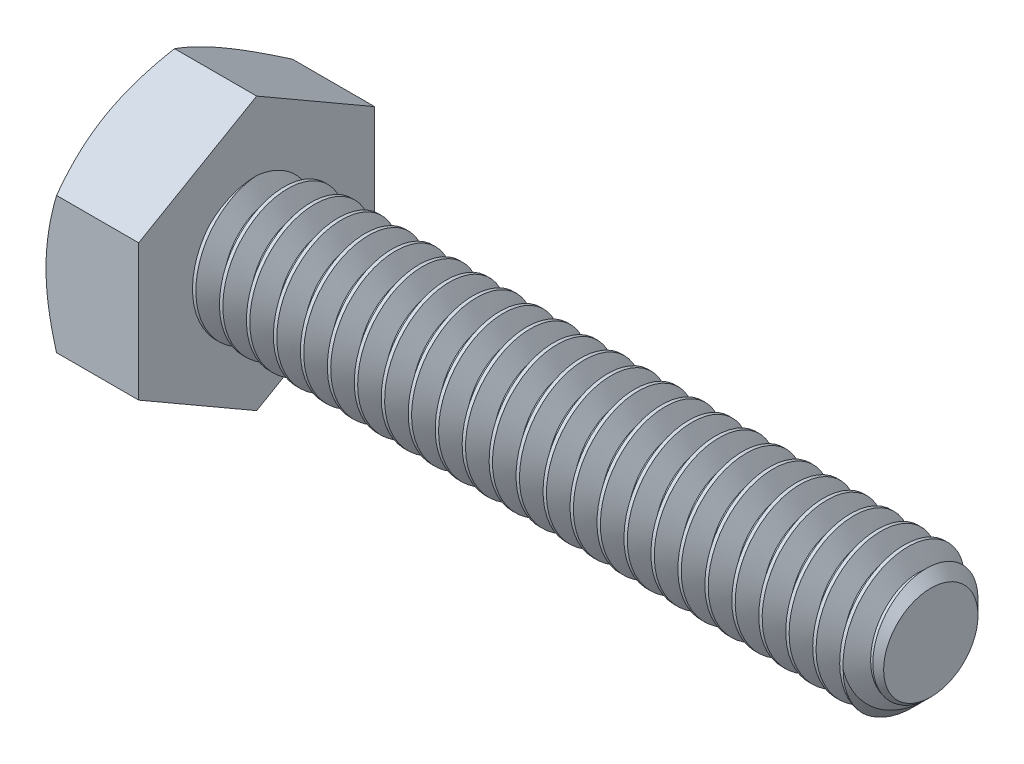
from build123d import *

# Parameters (mm, degrees)
SKETCH5_R           = 3.175
BOSS_EXTRUDE3_DEPTH = 31.75
CHAMFER1_SIZE       = 0.9525
CUT_SWEEP1_PITCH    = 1.27
BOSS_EXTRUDE4_DEPTH = 4.365625
SKETCH8_OUTSIDE_W   = 153.074
SKETCH8_OUTSIDE_H   = 154.794
SKETCH8_OUTSIDE_R   = 5.55625
CUT_EXTRUDE3_DEPTH  = 38.099499254
CUT_EXTRUDE3_DRAFT  = -60
CUT_EXTRUDE4_DEPTH  = 0.254
CIRPATTERN1_COUNT   = 6


with BuildPart() as part:
    # Sketch5 → Boss-Extrude3 (new body)
    with BuildSketch(Plane(origin=(18.0578125, 0, 0), x_dir=(0, 0, -1), z_dir=(1, 0, 0))):
        Circle(SKETCH5_R)
    extrude(amount=-BOSS_EXTRUDE3_DEPTH)

    # Chamfer1
    chamfer1_edges = [part.edges().sort_by_distance(p)[0] for p in [
        (18.0578125, 0, 3.175),
    ]]
    chamfer(chamfer1_edges, length=CHAMFER1_SIZE)

    # Cut-Sweep1: the profile of Sketch10 profile screwed along a right-hand helix of 26 turns, 8 arcs to a turn; built about Z, then put on its axis
    cut_sweep1_z = Axis((0, 0, 0), (0, 0, 1))
    cut_sweep1_corners = [(3.1753, 0, 0.000173205), (2.350110803, 0, -0.47625), (2.350110803, 0, -0.635), (3.1753, 0, -1.111423205)]
    with BuildLine(mode=Mode.PRIVATE) as cut_sweep1_profile:
        Line(cut_sweep1_corners[0], cut_sweep1_corners[1])
        Line(cut_sweep1_corners[1], cut_sweep1_corners[2])
        Line(cut_sweep1_corners[2], cut_sweep1_corners[3])
        Line(cut_sweep1_corners[3], cut_sweep1_corners[0])
    cut_sweep1_cap = Face(cut_sweep1_profile.wire())
    cut_sweep1_turn_angles = [0, 22.5, 45, 67.5, 90, 112.5, 135, 157.5, 180, 202.5, 225, 247.5, 270, 292.5, 315, 337.5, 360]
    cut_sweep1_turn_weights = [1, 0.9238795325112867, 1, 0.9238795325112867, 1, 0.9238795325112867, 1, 0.9238795325112867, 1, 0.9238795325112867, 1, 0.9238795325112867, 1, 0.9238795325112867, 1, 0.9238795325112867, 1]
    cut_sweep1_turn_rails = [Edge.make_bspline([Vector(p[0], p[1], 0).rotate(cut_sweep1_z, cut_sweep1_turn_angles[k]) / cut_sweep1_turn_weights[k] + Vector(0, 0, p[2] + CUT_SWEEP1_PITCH * cut_sweep1_turn_angles[k] / 360) for k in range(17)], [0, 0, 0, 1, 1, 2, 2, 3, 3, 4, 4, 5, 5, 6, 6, 7, 7, 8, 8, 8], 2, cut_sweep1_turn_weights) for p in cut_sweep1_corners]
    cut_sweep1_turn_sides = [Face.make_surface_from_curves(cut_sweep1_turn_rails[p[0]], cut_sweep1_turn_rails[p[1]]) for p in [(0, 1), (1, 2), (2, 3), (3, 0)]]
    cut_sweep1 = Plane(origin=(18.0578125, 0, 0), x_dir=(0, 1, 0), z_dir=(-1, 0, 0)) * Solid(Shell([*[p.moved(Location((0, 0, CUT_SWEEP1_PITCH * i))) for i in range(26) for p in cut_sweep1_turn_sides], cut_sweep1_cap, cut_sweep1_cap.rotate(cut_sweep1_z, 9360).moved(Location((0, 0, CUT_SWEEP1_PITCH * 9360 / 360)))]))
    add(cut_sweep1, mode=Mode.SUBTRACT)

    # Sketch6 → Boss-Extrude4 (add)
    with BuildSketch(Plane.ZY.offset(13.6921875)):
        Polygon((5.55625, 3.207902433), (0, 6.415804866), (-5.55625, 3.207902433), (-5.55625, -3.207902433), (0, -6.415804866), (5.55625, -3.207902433), align=None)
    extrude(amount=BOSS_EXTRUDE4_DEPTH)


with BuildPart() as cut_extrude3_tool:
    # Sketch8 outside → Cut-Extrude3 (with draft: the straight prism first)
    with BuildSketch(Plane.ZY.offset(18.0578125)):
        Rectangle(SKETCH8_OUTSIDE_W, SKETCH8_OUTSIDE_H)
        Circle(SKETCH8_OUTSIDE_R, mode=Mode.SUBTRACT)
    extrude(amount=-CUT_EXTRUDE3_DEPTH)
    # Cut-Extrude3: the draft: its side faces are tilted about the plane it starts from
    cut_extrude3_sides = [cut_extrude3_tool.faces().sort_by_distance(p)[0] for p in [
        (0.991937127, -77.397, 0),
        (0.991937127, 0, 76.537),
        (0.991937127, 77.397, 0),
        (0.991937127, 0, -76.537),
        (0.991937127, 0, -5.55625),
    ]]
    draft(cut_extrude3_sides, Plane.ZY.offset(18.0578125), CUT_EXTRUDE3_DRAFT)


with BuildPart() as part_1:
    add(part.part)

    # Cut-Extrude3: cut by cut_extrude3_tool
    add(cut_extrude3_tool.part, mode=Mode.SUBTRACT)

    # Sketch12 → Cut-Extrude4 (cut)
    with BuildSketch(Plane.ZY.offset(18.0578125)):
        with BuildLine():
            Line((0.1666875, 4.2783125), (0.1666875, 2.3891875))
            ThreePointArc((0.1666875, 2.3891875), (0, 2.2225), (-0.1666875, 2.3891875))
            Line((-0.1666875, 2.3891875), (-0.1666875, 4.2783125))
            ThreePointArc((-0.1666875, 4.2783125), (0, 4.445), (0.1666875, 4.2783125))
        make_face()
    cut_extrude4 = extrude(amount=-CUT_EXTRUDE4_DEPTH, mode=Mode.SUBTRACT)

    # CirPattern1: Cut-Extrude4 ×6 about axis
    cirpattern1_axis = Axis((0, 0, 0), (1, 0, 0))
    for i in range(1, CIRPATTERN1_COUNT):
        add(cut_extrude4.rotate(cirpattern1_axis, i * 360 / CIRPATTERN1_COUNT), mode=Mode.SUBTRACT)


solid = part_1.part
